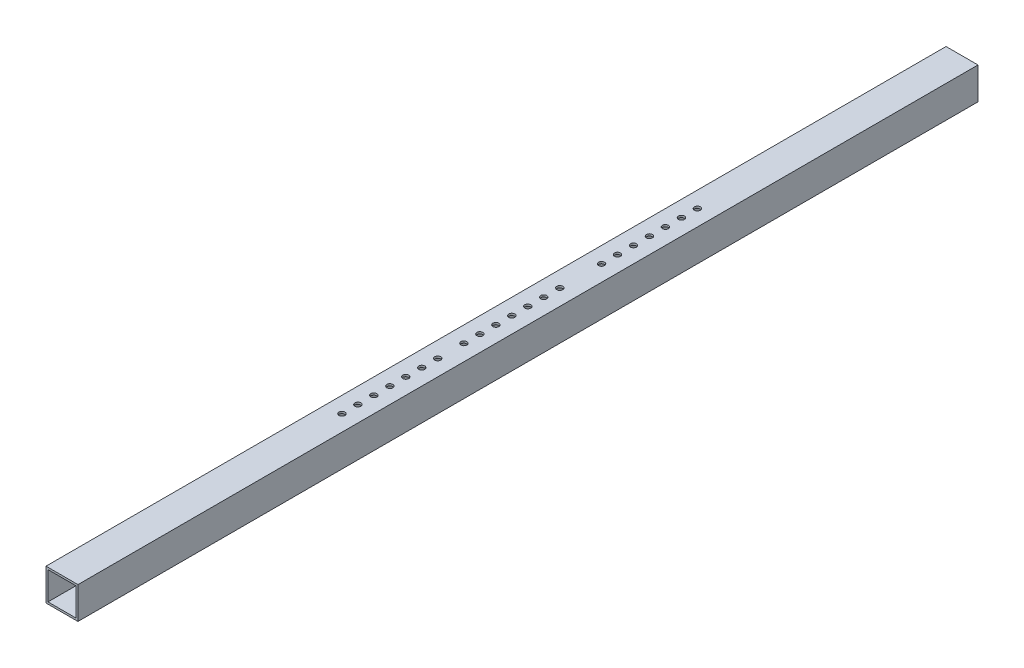
from build123d import *

# Parameters (mm, degrees)
SKETCH1_W           = 25.4
SKETCH1_H           = 25.4
SKETCH1_W_2         = 22.225
SKETCH1_H_2         = 22.225
BOSS_EXTRUDE1_DEPTH = 357.759
SKETCH2_R           = 2.38125
CUT_EXTRUDE1_DEPTH  = 359.884315736
SKETCH3_R           = 2.38125
CUT_EXTRUDE2_DEPTH  = 359.884315736


with BuildPart() as part:
    # Sketch1 → Boss-Extrude1 (new, symmetric)
    with BuildSketch(Plane.XY):
        Rectangle(SKETCH1_W, SKETCH1_H)
        Rectangle(SKETCH1_W_2, SKETCH1_H_2, mode=Mode.SUBTRACT)
    extrude(amount=BOSS_EXTRUDE1_DEPTH, both=True)

    # Sketch2 → Cut-Extrude1 (cut, through all)
    with BuildSketch(Plane.XZ.offset(12.7)):
        with Locations((0, -37.973)):
            Circle(SKETCH2_R)
        with Locations((0, -25.273)):
            Circle(SKETCH2_R)
        with Locations((0, -12.573)):
            Circle(SKETCH2_R)
        with Locations((0, 0.127)):
            Circle(SKETCH2_R)
        with Locations((0, 12.827)):
            Circle(SKETCH2_R)
        with Locations((0, 25.527)):
            Circle(SKETCH2_R)
        with Locations((0, 38.227)):
            Circle(SKETCH2_R)
    extrude(amount=-CUT_EXTRUDE1_DEPTH, mode=Mode.SUBTRACT)

    # Sketch3 → Cut-Extrude2 (cut, through all)
    with BuildSketch(Plane.XZ.offset(12.7)):
        with Locations((0, 59.018644472)):
            Circle(SKETCH3_R)
        with Locations((0, 71.718644472)):
            Circle(SKETCH3_R)
        with Locations((0, 84.418644472)):
            Circle(SKETCH3_R)
        with Locations((0, 109.818644472)):
            Circle(SKETCH3_R)
        with Locations((0, 122.518644472)):
            Circle(SKETCH3_R)
        with Locations((0, 135.218644472)):
            Circle(SKETCH3_R)
        with Locations((0, 97.118644472)):
            Circle(SKETCH3_R)
        with Locations((0, -71.18135497)):
            Circle(SKETCH3_R)
        with Locations((0, -83.88135497)):
            Circle(SKETCH3_R)
        with Locations((0, -96.58135497)):
            Circle(SKETCH3_R)
        with Locations((0, -109.28135497)):
            Circle(SKETCH3_R)
        with Locations((0, -121.98135497)):
            Circle(SKETCH3_R)
        with Locations((0, -134.68135497)):
            Circle(SKETCH3_R)
        with Locations((0, -147.38135497)):
            Circle(SKETCH3_R)
    extrude(amount=-CUT_EXTRUDE2_DEPTH, mode=Mode.SUBTRACT)


solid = part.part
